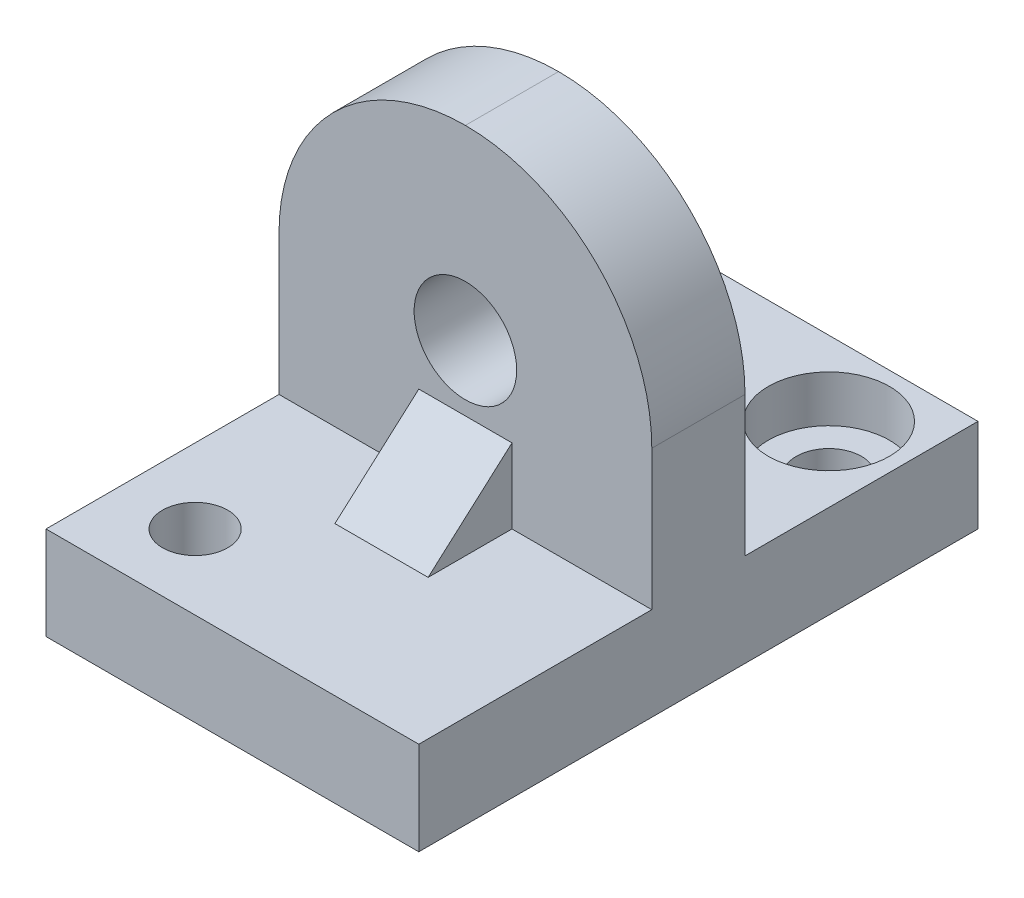
from build123d import *

# Parameters (mm, degrees)
EXTRUDE_1_DEPTH      = 20
EXTRUDE_1_DEPTH_BACK = 20
SKETCH_1_W           = 10
SKETCH_1_H           = 35
FILLET_1_R           = 20
SKETCH_2_R           = 5.5
CUT_EXTRUDE_1_DEPTH  = 49.79805324
EXTRUDE_2_DEPTH      = 5
EXTRUDE_2_DEPTH_BACK = 5
SKETCH_3_R           = 3.5
CUT_EXTRUDE_2_DEPTH  = 51.249378106
SKETCH_4_R           = 6.5
CUT_EXTRUDE_3_DEPTH  = 5


with BuildPart() as part:
    # Эскиз1 → Бобышка-Вытянуть1 (new, two sides: drawn at the far end of the back side and taken through both)
    with BuildSketch(Plane(origin=(0, 0, 0), x_dir=(0, 0, -1), z_dir=(1, 0, 0)).offset(-EXTRUDE_1_DEPTH_BACK)):
        Rectangle(SKETCH_1_W, SKETCH_1_H)
        Polygon((-5, -17.5), (-14, -17.5), (-30, -17.5), (-30, -27.5), (30, -27.5), (30, -17.5), (14, -17.5), (5, -17.5), align=None)
    extrude(amount=EXTRUDE_1_DEPTH + EXTRUDE_1_DEPTH_BACK)

    # Скругление1
    fillet_1_edges = [part.edges().sort_by_distance(p)[0] for p in [
        (-20, 17.5, 0),
        (20, 17.5, 0),
    ]]
    fillet(fillet_1_edges, radius=FILLET_1_R - 0.0001)  # a hair under: the kernel refuses the full size

    # Эскиз2 → Вырез-Вытянуть1 (cut, through all)
    with BuildSketch(Plane.XY.offset(5)):
        with Locations((0, -2.5)):
            Circle(SKETCH_2_R)
    extrude(amount=-CUT_EXTRUDE_1_DEPTH, mode=Mode.SUBTRACT)

    # Эскиз1<3> → Бобышка-Вытянуть2 (add, two sides: drawn at the far end of the back side and taken through both)
    with BuildSketch(Plane(origin=(0, 0, 0), x_dir=(0, 0, -1), z_dir=(1, 0, 0)).offset(-EXTRUDE_2_DEPTH_BACK)):
        Polygon((-5, -9.5), (-14, -17.5), (-5, -17.5), align=None)
        Polygon((5, -9.5), (5, -17.5), (14, -17.5), align=None)
    extrude(amount=EXTRUDE_2_DEPTH + EXTRUDE_2_DEPTH_BACK)

    # Эскиз3 → Вырез-Вытянуть2 (cut, through all)
    with BuildSketch(Plane(origin=(0, -17.5, 0), x_dir=(1, 0, 0), z_dir=(0, 1, 0))):
        with Locations(Location((-12, -22, 0), (0, 0, 270))):
            Circle(SKETCH_3_R)
        with Locations(Location((12, 22, 0), (0, 0, 270))):
            Circle(SKETCH_3_R)
    extrude(amount=-CUT_EXTRUDE_2_DEPTH, mode=Mode.SUBTRACT)

    # Эскиз4 → Вырез-Вытянуть3 (cut)
    with BuildSketch(Plane(origin=(0, -17.5, 0), x_dir=(1, 0, 0), z_dir=(0, 1, 0))):
        with Locations(Location((12, 22, 0), (0, 0, 270))):
            Circle(SKETCH_4_R)
    extrude(amount=-CUT_EXTRUDE_3_DEPTH, mode=Mode.SUBTRACT)


solid = part.part
